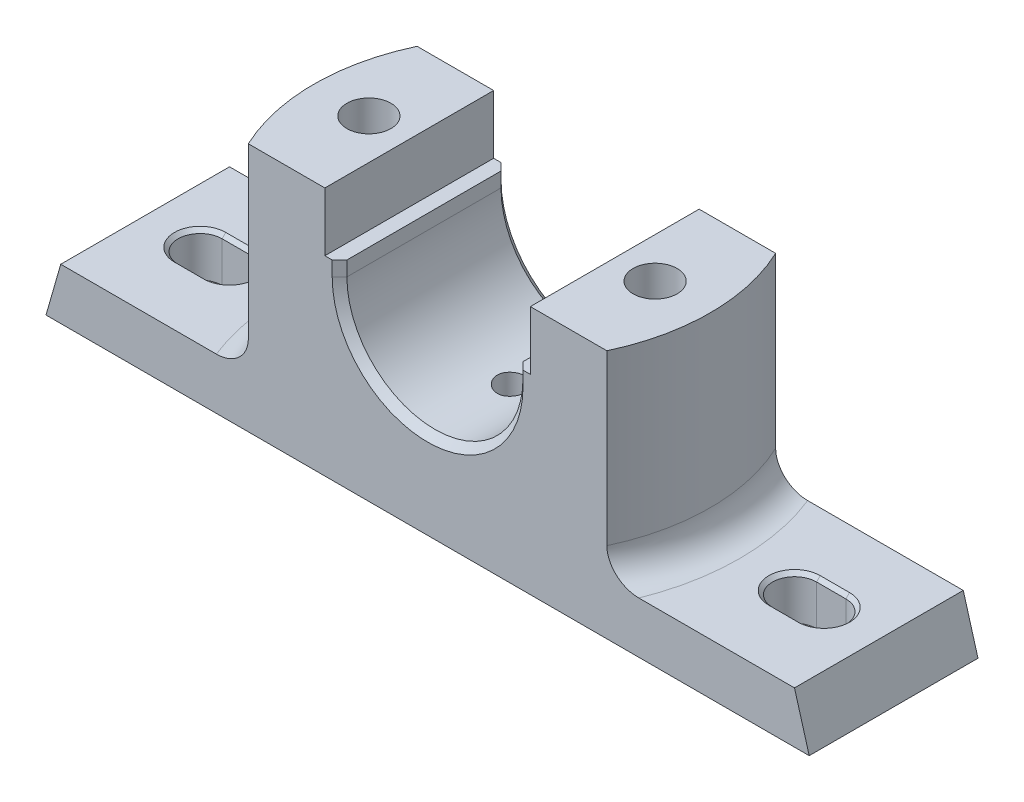
from build123d import *

# Parameters (mm, degrees)
BOSS_EXTRUDE1_DEPTH = 23
CUT_EXTRUDE1_START  = -54
CUT_EXTRUDE1_DEPTH  = 54
CUT_EXTRUDE2_REACH  = 128.369
SKETCH3_R           = 6
SKETCH3_3_W         = 28
SKETCH3_3_H         = 28
SKETCH3_3_R         = 6
CUT_EXTRUDE3_DEPTH  = 12
SKETCH3_4_W         = 195
SKETCH3_4_H         = 35
SKETCH3_4_W_2       = 28
SKETCH3_4_H_2       = 28
CUT_EXTRUDE4_DEPTH  = 2
FILLET1_R           = 8
CHAMFER1_SIZE       = 2
CHAMFER2_SIZE       = 1
SKETCH4_R           = 4
CUT_EXTRUDE5_DEPTH  = 52


# Read off the part's stored shape, not the designer's step: Cut-Extrude1
with BuildPart() as part:
    # Sketch1 → Boss-Extrude1 (new, symmetric)
    with BuildSketch(Plane.XY):
        with BuildLine():
            Line((-104, 0), (104, 0))
            Line((104, 0), (99.985564599, 14))
            Line((99.985564599, 14), (54, 14))
            Line((54, 14), (54, 68))
            Line((54, 68), (28, 68))
            Line((28, 68), (28, 52))
            Line((28, 52), (24, 52))
            Line((24, 52), (24, 48))
            ThreePointArc((24, 48), (0, 24), (-24, 48))
            Line((-24, 48), (-24, 52))
            Line((-24, 52), (-28, 52))
            Line((-28, 52), (-28, 68))
            Line((-28, 68), (-54, 68))
            Line((-54, 68), (-54, 14))
            Line((-54, 14), (-99.985564599, 14))
            Line((-99.985564599, 14), (-104, 0))
        make_face()
    extrude(amount=BOSS_EXTRUDE1_DEPTH, both=True)

    # Cut-Extrude1 outline → Cut-Extrude1 (cut)
    with BuildSketch(Plane(origin=(0, 68, 0), x_dir=(1, 0, 0), z_dir=(0, 1, 0)).offset(CUT_EXTRUDE1_START)):
        with BuildLine():
            ThreePointArc((-54, 0), (-52.698550436, 11.784005345), (-48.856934001, 23))
            Line((-48.856934001, 23), (-54, 23))
            Line((-54, 23), (-54, 0))
        make_face()
        with BuildLine():
            ThreePointArc((-48.856934001, -23), (-52.698550436, -11.784005345), (-54, 0))
            Line((-54, 0), (-54, -23))
            Line((-54, -23), (-48.856934001, -23))
        make_face()
        with BuildLine():
            Line((54, 23), (48.856934001, 23))
            ThreePointArc((48.856934001, 23), (52.698550436, 11.784005345), (54, 0))
            Line((54, 0), (54, 23))
        make_face()
        with BuildLine():
            Line((54, -23), (54, 0))
            ThreePointArc((54, 0), (52.698550436, -11.784005345), (48.856934001, -23))
            Line((48.856934001, -23), (54, -23))
        make_face()
    extrude(amount=CUT_EXTRUDE1_DEPTH, mode=Mode.SUBTRACT)

    # Sketch3 → Cut-Extrude2 (cut, up to next)
    with BuildSketch(Plane.XZ, mode=Mode.PRIVATE) as cut_extrude2_sk1:
        with Locations(Location((-39, 0, 0), (0, 0, 270))):
            Circle(SKETCH3_R)
    cut_extrude2_tool1 = extrude(cut_extrude2_sk1.sketch, amount=-CUT_EXTRUDE2_REACH, mode=Mode.PRIVATE) & part.part
    # Sketch3 → Cut-Extrude2 (cut, up to next)
    with BuildSketch(Plane.XZ, mode=Mode.PRIVATE) as cut_extrude2_sk2:
        with Locations(Location((39, 0, 0), (0, 0, 270))):
            Circle(SKETCH3_R)
    cut_extrude2_tool2 = extrude(cut_extrude2_sk2.sketch, amount=-CUT_EXTRUDE2_REACH, mode=Mode.PRIVATE) & part.part
    # Sketch3 → Cut-Extrude2 (cut, up to next)
    with BuildSketch(Plane.XZ, mode=Mode.PRIVATE) as cut_extrude2_sk3:
        with BuildLine():
            Line((77, -6), (85, -6))
            ThreePointArc((85, -6), (91, 0), (85, 6))
            Line((85, 6), (77, 6))
            ThreePointArc((77, 6), (71, 0), (77, -6))
        make_face()
    cut_extrude2_tool3 = extrude(cut_extrude2_sk3.sketch, amount=-CUT_EXTRUDE2_REACH, mode=Mode.PRIVATE) & part.part
    # Sketch3 → Cut-Extrude2 (cut, up to next)
    with BuildSketch(Plane.XZ, mode=Mode.PRIVATE) as cut_extrude2_sk4:
        with BuildLine():
            ThreePointArc((-85, -6), (-91, 0), (-85, 6))
            Line((-85, 6), (-77, 6))
            ThreePointArc((-77, 6), (-71, 0), (-77, -6))
            Line((-77, -6), (-85, -6))
        make_face()
    cut_extrude2_tool4 = extrude(cut_extrude2_sk4.sketch, amount=-CUT_EXTRUDE2_REACH, mode=Mode.PRIVATE) & part.part
    add(cut_extrude2_tool1.solids().sort_by_distance((-39, 0, 0))[0], mode=Mode.SUBTRACT)
    add(cut_extrude2_tool2.solids().sort_by_distance((39, 0, 0))[0], mode=Mode.SUBTRACT)
    add(cut_extrude2_tool3.solids().sort_by_distance((81, 0, 0))[0], mode=Mode.SUBTRACT)
    add(cut_extrude2_tool4.solids().sort_by_distance((-81, 0, 0))[0], mode=Mode.SUBTRACT)

    # Sketch3<3> → Cut-Extrude3 (cut)
    # profile 1 of 2: a face of its own
    with BuildSketch(Plane.XZ):
        with Locations((39, 0)):
            Rectangle(SKETCH3_3_W, SKETCH3_3_H)
        with Locations(Location((39, 0, 0), (0, 0, 270))):
            Circle(SKETCH3_3_R, mode=Mode.SUBTRACT)
    # profile 2 of 2: a face of its own
    with BuildSketch(Plane.XZ):
        with Locations((-39, 0)):
            Rectangle(SKETCH3_3_W, SKETCH3_3_H)
        with Locations(Location((-39, 0, 0), (0, 0, 270))):
            Circle(SKETCH3_3_R, mode=Mode.SUBTRACT)
    extrude(amount=-CUT_EXTRUDE3_DEPTH, mode=Mode.SUBTRACT)

    # Sketch3<4> → Cut-Extrude4 (cut)
    with BuildSketch(Plane.XZ):
        Rectangle(SKETCH3_4_W, SKETCH3_4_H)
        with BuildLine():
            ThreePointArc((85, -6), (91, 0), (85, 6))
            Line((85, 6), (77, 6))
            ThreePointArc((77, 6), (71, 0), (77, -6))
            Line((77, -6), (85, -6))
        make_face(mode=Mode.SUBTRACT)
        with Locations((-39, 0)):
            Rectangle(SKETCH3_4_W_2, SKETCH3_4_H_2, mode=Mode.SUBTRACT)
        with Locations((39, 0)):
            Rectangle(SKETCH3_4_W_2, SKETCH3_4_H_2, mode=Mode.SUBTRACT)
        with BuildLine():
            Line((-77, -6), (-85, -6))
            ThreePointArc((-85, -6), (-91, 0), (-85, 6))
            Line((-85, 6), (-77, 6))
            ThreePointArc((-77, 6), (-71, 0), (-77, -6))
        make_face(mode=Mode.SUBTRACT)
    extrude(amount=-CUT_EXTRUDE4_DEPTH, mode=Mode.SUBTRACT)

    # Fillet1
    fillet1_edges = [part.edges().sort_by_distance(p)[0] for p in [
        (-52.698550436, 14, -11.784005345),
        (52.698550436, 14, -11.784005345),
    ]]
    fillet(fillet1_edges, radius=FILLET1_R)

    # Chamfer1
    chamfer1_edges = [part.edges().sort_by_distance(p)[0] for p in [
        (-24, 50, -23),
        (0, 24, -23),
        (24, 50, -23),
        (24, 50, 23),
        (0, 24, 23),
        (-24, 50, 23),
    ]]
    chamfer(chamfer1_edges, length=CHAMFER1_SIZE)

    # Chamfer2
    chamfer2_edges = [part.edges().sort_by_distance(p)[0] for p in [
        (91, 14, 0),
        (81, 14, -6),
        (71, 14, 0),
        (-91, 14, 0),
        (-71, 14, 0),
        (-81, 14, -6),
        (-81, 14, 6),
        (81, 14, 6),
    ]]
    chamfer(chamfer2_edges, length=CHAMFER2_SIZE)

    # Sketch4 → Cut-Extrude5 (cut)
    with BuildSketch(Plane(origin=(0, 68, 0), x_dir=(1, 0, 0), z_dir=(0, 1, 0))):
        with Locations(Location((0, 0, 0), (0, 0, 180))):
            Circle(SKETCH4_R)
    extrude(amount=-CUT_EXTRUDE5_DEPTH, mode=Mode.SUBTRACT)


solid = part.part
